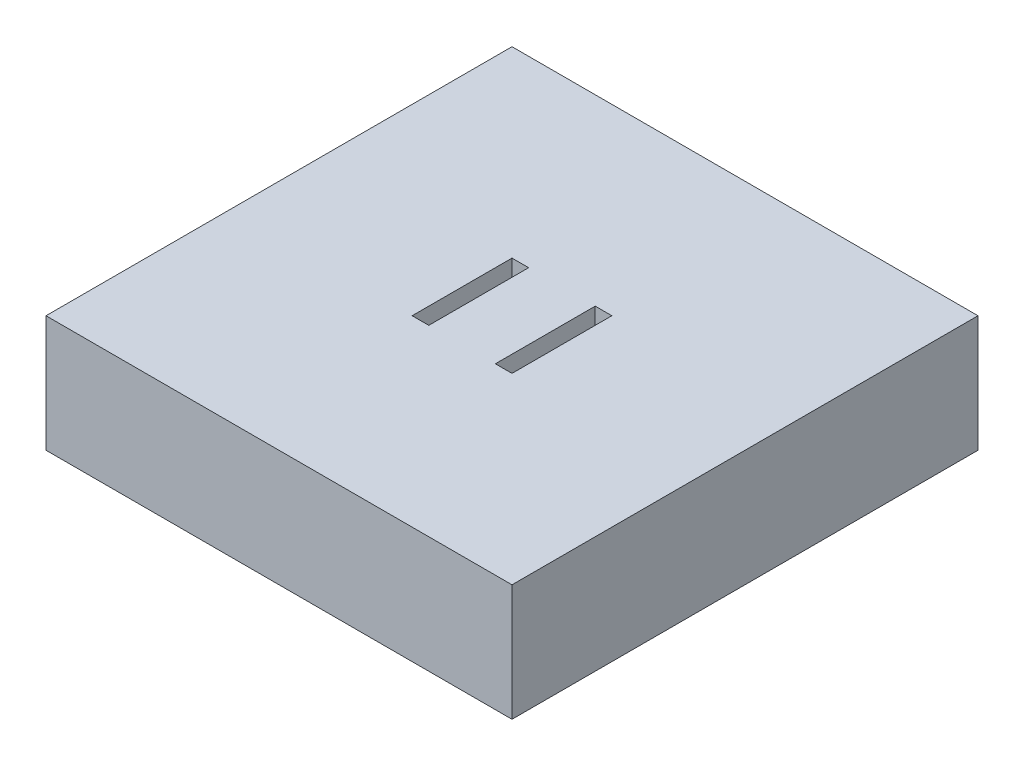
from build123d import *

# Parameters (mm, degrees)
SKETCH1_W           = 28
SKETCH1_H           = 28
SKETCH1_R           = 10.625
BOSS_EXTRUDE1_DEPTH = 2.5
SKETCH2_W           = 28
SKETCH2_H           = 28
SKETCH2_W_2         = 1
SKETCH2_H_2         = 6
BOSS_EXTRUDE2_DEPTH = 2
BOSS_EXTRUDE3_DEPTH = 3
CHAMFER1_SIZE       = 1


with BuildPart() as part:
    # Sketch1 → Boss-Extrude1 (new, symmetric)
    with BuildSketch(Plane(origin=(0, 0, 0), x_dir=(1, 0, 0), z_dir=(0, 1, 0))):
        Rectangle(SKETCH1_W, SKETCH1_H)
        with Locations(Location((0, 0, 0), (0, 0, 270))):
            Circle(SKETCH1_R, mode=Mode.SUBTRACT)
    extrude(amount=BOSS_EXTRUDE1_DEPTH, both=True)

    # Sketch2 → Boss-Extrude2 (add)
    with BuildSketch(Plane(origin=(0, 2.5, 0), x_dir=(1, 0, 0), z_dir=(0, 1, 0))):
        Rectangle(SKETCH2_W, SKETCH2_H)
        with Locations((-2.5, 0)):
            Rectangle(SKETCH2_W_2, SKETCH2_H_2, mode=Mode.SUBTRACT)
        with Locations((2.5, 0)):
            Rectangle(SKETCH2_W_2, SKETCH2_H_2, mode=Mode.SUBTRACT)
    extrude(amount=BOSS_EXTRUDE2_DEPTH)

    # Sketch3 → Boss-Extrude3 (add, symmetric)
    with BuildSketch(Plane.XY):
        with BuildLine():
            Line((-2, 2.5), (2, 2.5))
            ThreePointArc((2, 2.5), (0, 0.97783361), (-2, 2.5))
        make_face()
    extrude(amount=BOSS_EXTRUDE3_DEPTH, both=True)

    # Chamfer1
    # the kernel refuses this chamfer: 1 mm, written as the material it adds along each edge
    with BuildSketch(Plane(origin=(-4.571682988, 2.5, -3), x_dir=(0, 0.027495876610586487, -0.9996219169112968), z_dir=(1, 0, 0))) as chamfer1_piece_1_section:
        Polygon((CHAMFER1_SIZE * 0.999621916911, -CHAMFER1_SIZE * 0.0274958766106), (-CHAMFER1_SIZE * 0.0274958766106, -CHAMFER1_SIZE * 0.999621916911), (0, 0), align=None)
    chamfer1_piece_1 = extrude(amount=9.143365976, mode=Mode.PRIVATE)
    chamfer1_piece_1 = chamfer1_piece_1 & Plane(origin=(0, 3.05283361, -3.341258545), x_dir=(0.9638554216867474, -0.266425835993926, 0), z_dir=(0, 0, 1)) * Cylinder(2.075, 23, mode=Mode.PRIVATE)
    add(chamfer1_piece_1)
    with BuildSketch(Plane(origin=(-4.571682988, 2.5, 3), x_dir=(0, 0.027495876610586487, 0.9996219169112968), z_dir=(1, 0, 0))) as chamfer1_piece_2_section:
        Polygon((CHAMFER1_SIZE * 0.999621916911, CHAMFER1_SIZE * 0.0274958766106), (-CHAMFER1_SIZE * 0.0274958766106, CHAMFER1_SIZE * 0.999621916911), (0, 0), align=None)
    chamfer1_piece_2 = extrude(amount=9.143365976, mode=Mode.PRIVATE)
    chamfer1_piece_2 = chamfer1_piece_2 & Plane(origin=(0, 3.05283361, 3.341258545), x_dir=(0.9638554216867474, -0.266425835993926, 0), z_dir=(0, 0, 1)) * Cylinder(2.075, 23, mode=Mode.PRIVATE)
    add(chamfer1_piece_2)


solid = part.part
